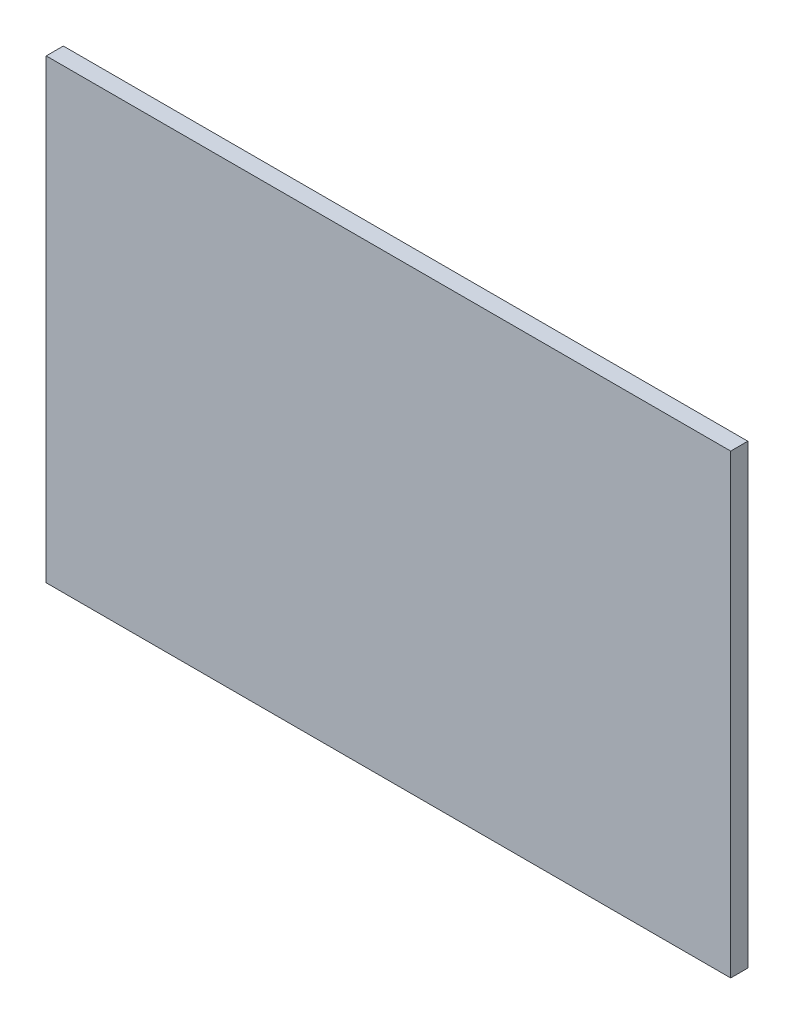
from build123d import *

# Parameters (mm, degrees)
SKETCH_1_W             = 120
SKETCH_1_H             = 80
SM_BASE_FLANGE_1_DEPTH = 3


# Sheet-metal steps are written as plain solids
with BuildPart() as part:
    # Sketch 1 → Базовая кромка1 (new body)
    with BuildSketch(Plane.XY):
        Rectangle(SKETCH_1_W, SKETCH_1_H)
    extrude(amount=-SM_BASE_FLANGE_1_DEPTH)


solid = part.part
